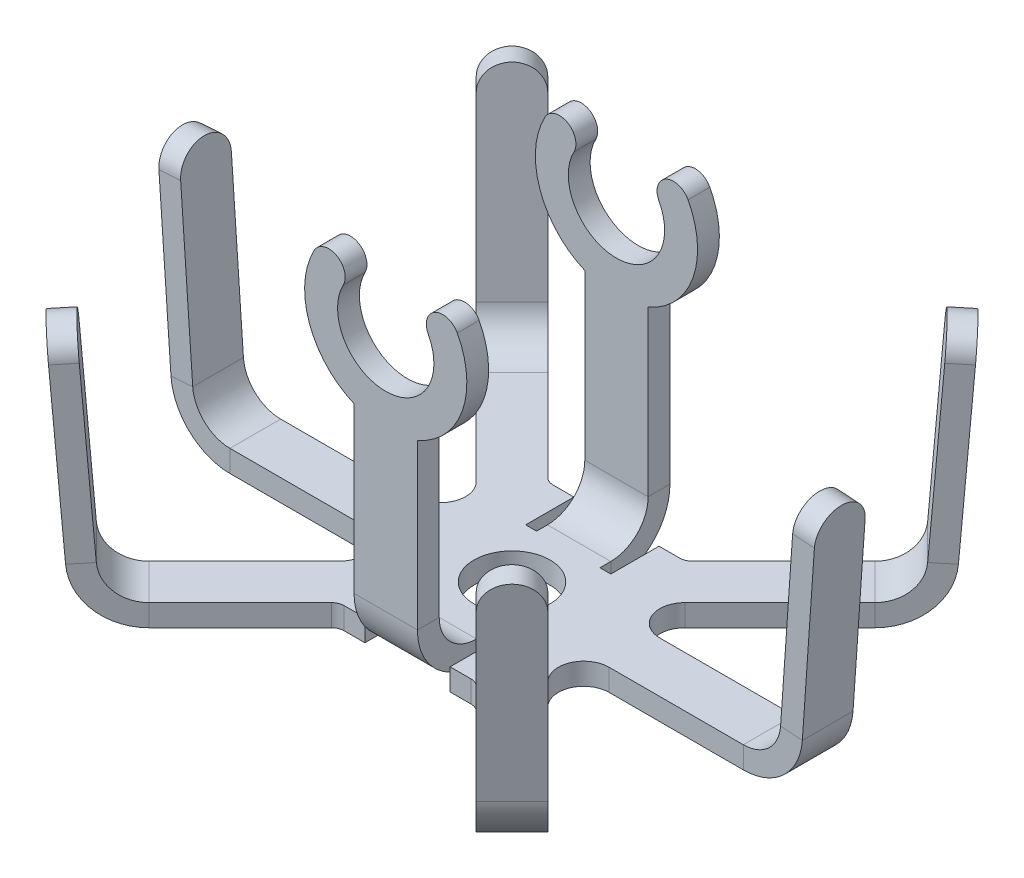
from build123d import *

# Parameters (mm, degrees)
SKETCH1_R                       = 0.75
BASE_FLANGE1_DEPTH              = 0.43
EDGE_FLANGE1_STRIP_CUT_DEPTH    = 1
EDGE_FLANGE1_DEPTH              = 1
FILLET1_RADIUS                  = 0.5
FILLET1_LENGTH                  = 0.43
CIRPATTERN1_COUNT               = 8
FILLET1_OF_CIRPATTERN1_2_RADIUS = 0.5
FILLET1_OF_CIRPATTERN1_2_LENGTH = 0.43
FILLET1_OF_CIRPATTERN1_3_RADIUS = 0.5
FILLET1_OF_CIRPATTERN1_3_LENGTH = 0.43
FILLET1_OF_CIRPATTERN1_4_RADIUS = 0.5
FILLET1_OF_CIRPATTERN1_4_LENGTH = 0.43
FILLET1_OF_CIRPATTERN1_5_RADIUS = 0.5
FILLET1_OF_CIRPATTERN1_5_LENGTH = 0.43
FILLET1_OF_CIRPATTERN1_6_RADIUS = 0.5
FILLET1_OF_CIRPATTERN1_6_LENGTH = 0.43
EDGE_FLANGE2_STRIP_W            = 3.1932
EDGE_FLANGE2_STRIP_H            = 0.43
EDGE_FLANGE2_STRIP_CUT_DEPTH    = 1.25
EDGE_FLANGE2_RELIEF_W           = 3.4082
EDGE_FLANGE2_RELIEF_H           = 0.215
EDGE_FLANGE2_RELIEF_CUT_DEPTH   = 0.43
EDGE_FLANGE2_DEPTH              = 1.25
TAB1_DEPTH                      = 0.43
FILLET2_R                       = 0.25


# Sheet-metal steps are written as plain solids
with BuildPart() as part:
    # Sketch1 → Base-Flange1 (new body)
    with BuildSketch(Plane(origin=(0, 0, 0), x_dir=(1, 0, 0), z_dir=(0, 1, 0))):
        with BuildLine():
            Line((5.75, 0.5), (2.414213562, 0.5))
            ThreePointArc((2.414213562, 0.5), (1.952273796, 0.808658284), (2.060660172, 1.353553391))
            Line((2.060660172, 1.353553391), (4.419417382, 3.712310601))
            Line((4.419417382, 3.712310601), (3.712310601, 4.419417382))
            Line((3.712310601, 4.419417382), (1.353553391, 2.060660172))
            Line((1.353553391, 2.060660172), (-1.353553391, 2.060660172))
            Line((-1.353553391, 2.060660172), (-3.712310601, 4.419417382))
            Line((-3.712310601, 4.419417382), (-4.419417382, 3.712310601))
            Line((-4.419417382, 3.712310601), (-2.060660172, 1.353553391))
            ThreePointArc((-2.060660172, 1.353553391), (-1.952273796, 0.808658284), (-2.414213562, 0.5))
            Line((-2.414213562, 0.5), (-5.75, 0.5))
            Line((-5.75, 0.5), (-5.75, -0.5))
            Line((-5.75, -0.5), (-2.414213562, -0.5))
            ThreePointArc((-2.414213562, -0.5), (-1.952273796, -0.808658284), (-2.060660172, -1.353553391))
            Line((-2.060660172, -1.353553391), (-4.419417382, -3.712310601))
            Line((-4.419417382, -3.712310601), (-3.712310601, -4.419417382))
            Line((-3.712310601, -4.419417382), (-1.353553391, -2.060660172))
            Line((-1.353553391, -2.060660172), (1.353553391, -2.060660172))
            Line((1.353553391, -2.060660172), (3.712310601, -4.419417382))
            Line((3.712310601, -4.419417382), (4.419417382, -3.712310601))
            Line((4.419417382, -3.712310601), (2.060660172, -1.353553391))
            ThreePointArc((2.060660172, -1.353553391), (1.952273796, -0.808658284), (2.414213562, -0.5))
            Line((2.414213562, -0.5), (5.75, -0.5))
            Line((5.75, -0.5), (5.75, 0.5))
        make_face()
        with Locations(Location((0, 0, 0), (0, 0, 270))):
            Circle(SKETCH1_R, mode=Mode.SUBTRACT)
    extrude(amount=-BASE_FLANGE1_DEPTH)

    # Edge-Flange1 strip (across the edge) → Edge-Flange1 strip cut (cut)
    with BuildSketch(Plane(origin=(4.419417382, 0, -3.712310601), x_dir=(-0.7053843046066381, 0.0697564737441289, 0.7053843046066409), z_dir=(-0.707106781186549, 0, -0.7071067811865462))):
        Polygon((-2.530199428, -0.254121237), (0.655222098, -0.476867609), (0.685217381, -0.047915067), (-2.500204144, 0.174831305), align=None)
    edge_flange1_strip_cut = extrude(amount=EDGE_FLANGE1_STRIP_CUT_DEPTH, mode=Mode.SUBTRACT)

    # Edge-Flange1 section (across the edge) → Edge-Flange1 (add)
    with BuildSketch(Plane(origin=(4.419417382, 0, -3.712310601), x_dir=(-0.7053843046066381, 0.0697564737441289, 0.7053843046066409), z_dir=(-0.707106781186549, 0, -0.7071067811865462))):
        with BuildLine():
            Line((-0.43, 0.686890612), (-0.43, 4.599018513))
            Line((-0.43, 4.599018513), (0, 4.599018513))
            Line((0, 4.599018513), (0, 0.686890612))
            ThreePointArc((0, 0.686890612), (0.197884863, 0.18453062), (0.685217381, -0.047915067))
            Line((0.685217381, -0.047915067), (0.655222098, -0.476867609))
            ThreePointArc((0.655222098, -0.476867609), (-0.116597228, -0.108728674), (-0.43, 0.686890612))
        make_face()
    edge_flange1 = extrude(amount=EDGE_FLANGE1_DEPTH)

    # Fillet1: full round fillet: the end face becomes a half cylinder, R = half its width
    fillet1_face = Plane((4.444369473, 4.572817893, -4.444369473), x_dir=(0.705384304607, -0.069756473744, -0.705384304607), z_dir=(0.049325275616, 0.99756405026, -0.049325275616))  # on the end face: x along it, z out of the body
    fillet1_slab = fillet1_face.offset(-FILLET1_RADIUS / 2) * Box(FILLET1_LENGTH, 2 * FILLET1_RADIUS, FILLET1_RADIUS, mode=Mode.PRIVATE)  # the body's end, R deep
    fillet1_round = Plane((4.419706835, 4.074035868, -4.419706835), x_dir=(0.049325275616, 0.99756405026, -0.049325275616), z_dir=(0.705384304607, -0.069756473744, -0.705384304607)) * Cylinder(FILLET1_RADIUS, FILLET1_LENGTH, mode=Mode.PRIVATE)  # its axis R under the face
    add(fillet1_slab - fillet1_round, mode=Mode.SUBTRACT)

    # CirPattern1: Edge-Flange1 strip cut, Edge-Flange1 ×8 about axis, 2 skipped
    cirpattern1_axis = Axis((0, -0.43, 0), (0, 1, 0))
    add([edge_flange1_strip_cut.rotate(cirpattern1_axis, i * 360 / CIRPATTERN1_COUNT) for i in range(1, CIRPATTERN1_COUNT) if i not in (1, 5)], mode=Mode.SUBTRACT)
    add([edge_flange1.rotate(cirpattern1_axis, i * 360 / CIRPATTERN1_COUNT) for i in range(1, CIRPATTERN1_COUNT) if i not in (1, 5)])

    # Fillet1 of CirPattern1 2: full round fillet: the end face becomes a half cylinder, R = half its width
    fillet1_of_cirpattern1_2_face = Plane((-4.444369473, 4.572817893, -4.444369473), x_dir=(-0.705384304607, -0.069756473744, -0.705384304607), z_dir=(-0.049325275616, 0.99756405026, -0.049325275616))  # on the end face: x along it, z out of the body
    fillet1_of_cirpattern1_2_slab = fillet1_of_cirpattern1_2_face.offset(-FILLET1_OF_CIRPATTERN1_2_RADIUS / 2) * Box(FILLET1_OF_CIRPATTERN1_2_LENGTH, 2 * FILLET1_OF_CIRPATTERN1_2_RADIUS, FILLET1_OF_CIRPATTERN1_2_RADIUS, mode=Mode.PRIVATE)  # the body's end, R deep
    fillet1_of_cirpattern1_2_round = Plane((-4.419706835, 4.074035868, -4.419706835), x_dir=(-0.049325275616, 0.99756405026, -0.049325275616), z_dir=(-0.705384304607, -0.069756473744, -0.705384304607)) * Cylinder(FILLET1_OF_CIRPATTERN1_2_RADIUS, FILLET1_OF_CIRPATTERN1_2_LENGTH, mode=Mode.PRIVATE)  # its axis R under the face
    add(fillet1_of_cirpattern1_2_slab - fillet1_of_cirpattern1_2_round, mode=Mode.SUBTRACT)

    # Fillet1 of CirPattern1 3: full round fillet: the end face becomes a half cylinder, R = half its width
    fillet1_of_cirpattern1_3_face = Plane((-6.285287585, 4.572817893, 0), x_dir=(-0.99756405026, -0.069756473744, 0), z_dir=(-0.069756473744, 0.99756405026, 0))  # on the end face: x along it, z out of the body
    fillet1_of_cirpattern1_3_slab = fillet1_of_cirpattern1_3_face.offset(-FILLET1_OF_CIRPATTERN1_3_RADIUS / 2) * Box(FILLET1_OF_CIRPATTERN1_3_LENGTH, 2 * FILLET1_OF_CIRPATTERN1_3_RADIUS, FILLET1_OF_CIRPATTERN1_3_RADIUS, mode=Mode.PRIVATE)  # the body's end, R deep
    fillet1_of_cirpattern1_3_round = Plane((-6.250409348, 4.074035868, 0), x_dir=(-0.069756473744, 0.99756405026, 0), z_dir=(-0.99756405026, -0.069756473744, 0)) * Cylinder(FILLET1_OF_CIRPATTERN1_3_RADIUS, FILLET1_OF_CIRPATTERN1_3_LENGTH, mode=Mode.PRIVATE)  # its axis R under the face
    add(fillet1_of_cirpattern1_3_slab - fillet1_of_cirpattern1_3_round, mode=Mode.SUBTRACT)

    # Fillet1 of CirPattern1 4: full round fillet: the end face becomes a half cylinder, R = half its width
    fillet1_of_cirpattern1_4_face = Plane((-4.444369473, 4.572817893, 4.444369473), x_dir=(-0.705384304607, -0.069756473744, 0.705384304607), z_dir=(-0.049325275616, 0.99756405026, 0.049325275616))  # on the end face: x along it, z out of the body
    fillet1_of_cirpattern1_4_slab = fillet1_of_cirpattern1_4_face.offset(-FILLET1_OF_CIRPATTERN1_4_RADIUS / 2) * Box(FILLET1_OF_CIRPATTERN1_4_LENGTH, 2 * FILLET1_OF_CIRPATTERN1_4_RADIUS, FILLET1_OF_CIRPATTERN1_4_RADIUS, mode=Mode.PRIVATE)  # the body's end, R deep
    fillet1_of_cirpattern1_4_round = Plane((-4.419706835, 4.074035868, 4.419706835), x_dir=(-0.049325275616, 0.99756405026, 0.049325275616), z_dir=(-0.705384304607, -0.069756473744, 0.705384304607)) * Cylinder(FILLET1_OF_CIRPATTERN1_4_RADIUS, FILLET1_OF_CIRPATTERN1_4_LENGTH, mode=Mode.PRIVATE)  # its axis R under the face
    add(fillet1_of_cirpattern1_4_slab - fillet1_of_cirpattern1_4_round, mode=Mode.SUBTRACT)

    # Fillet1 of CirPattern1 5: full round fillet: the end face becomes a half cylinder, R = half its width
    fillet1_of_cirpattern1_5_face = Plane((4.444369473, 4.572817893, 4.444369473), x_dir=(0.705384304607, -0.069756473744, 0.705384304607), z_dir=(0.049325275616, 0.99756405026, 0.049325275616))  # on the end face: x along it, z out of the body
    fillet1_of_cirpattern1_5_slab = fillet1_of_cirpattern1_5_face.offset(-FILLET1_OF_CIRPATTERN1_5_RADIUS / 2) * Box(FILLET1_OF_CIRPATTERN1_5_LENGTH, 2 * FILLET1_OF_CIRPATTERN1_5_RADIUS, FILLET1_OF_CIRPATTERN1_5_RADIUS, mode=Mode.PRIVATE)  # the body's end, R deep
    fillet1_of_cirpattern1_5_round = Plane((4.419706835, 4.074035868, 4.419706835), x_dir=(0.049325275616, 0.99756405026, 0.049325275616), z_dir=(0.705384304607, -0.069756473744, 0.705384304607)) * Cylinder(FILLET1_OF_CIRPATTERN1_5_RADIUS, FILLET1_OF_CIRPATTERN1_5_LENGTH, mode=Mode.PRIVATE)  # its axis R under the face
    add(fillet1_of_cirpattern1_5_slab - fillet1_of_cirpattern1_5_round, mode=Mode.SUBTRACT)

    # Fillet1 of CirPattern1 6: full round fillet: the end face becomes a half cylinder, R = half its width
    fillet1_of_cirpattern1_6_face = Plane((6.285287585, 4.572817893, 0), x_dir=(0.99756405026, -0.069756473744, 0), z_dir=(0.069756473744, 0.99756405026, 0))  # on the end face: x along it, z out of the body
    fillet1_of_cirpattern1_6_slab = fillet1_of_cirpattern1_6_face.offset(-FILLET1_OF_CIRPATTERN1_6_RADIUS / 2) * Box(FILLET1_OF_CIRPATTERN1_6_LENGTH, 2 * FILLET1_OF_CIRPATTERN1_6_RADIUS, FILLET1_OF_CIRPATTERN1_6_RADIUS, mode=Mode.PRIVATE)  # the body's end, R deep
    fillet1_of_cirpattern1_6_round = Plane((6.250409348, 4.074035868, 0), x_dir=(0.069756473744, 0.99756405026, 0), z_dir=(0.99756405026, -0.069756473744, 0)) * Cylinder(FILLET1_OF_CIRPATTERN1_6_RADIUS, FILLET1_OF_CIRPATTERN1_6_LENGTH, mode=Mode.PRIVATE)  # its axis R under the face
    add(fillet1_of_cirpattern1_6_slab - fillet1_of_cirpattern1_6_round, mode=Mode.SUBTRACT)

    # Edge-Flange2 strip (across the edge) → Edge-Flange2 strip cut (cut)
    with BuildSketch(Plane(origin=(0.625, 0, -2.060660172), x_dir=(0, 0, 1), z_dir=(-1, 0, 0))):
        with Locations((-0.86, -0.215)):
            Rectangle(EDGE_FLANGE2_STRIP_W, EDGE_FLANGE2_STRIP_H)
    edge_flange2_strip_cut = extrude(amount=EDGE_FLANGE2_STRIP_CUT_DEPTH, mode=Mode.SUBTRACT)

    # Edge-Flange2 relief (on the sheet) → Edge-Flange2 relief cut (cut)
    with BuildSketch(Plane(origin=(0.625, 0, -1.324060172), x_dir=(0, 0, 1), z_dir=(0, 1, 0))):
        with Locations((-1.4891, 0.1075)):
            Rectangle(EDGE_FLANGE2_RELIEF_W, EDGE_FLANGE2_RELIEF_H)
        with Locations((-1.4891, -1.3575)):
            Rectangle(EDGE_FLANGE2_RELIEF_W, EDGE_FLANGE2_RELIEF_H)
    edge_flange2_relief_cut = extrude(amount=-EDGE_FLANGE2_RELIEF_CUT_DEPTH, mode=Mode.SUBTRACT)

    # Edge-Flange2 section (across the edge) → Edge-Flange2 (add)
    with BuildSketch(Plane(origin=(0.625, 0, -2.060660172), x_dir=(0, 0, 1), z_dir=(-1, 0, 0))):
        with BuildLine():
            Line((-0.43, 0.7366), (-0.43, 4.5))
            Line((-0.43, 4.5), (0, 4.5))
            Line((0, 4.5), (0, 0.7366))
            ThreePointArc((0, 0.7366), (0.215745145, 0.215745145), (0.7366, 0))
            Line((0.7366, 0), (0.7366, -0.43))
            ThreePointArc((0.7366, -0.43), (-0.088310771, -0.088310771), (-0.43, 0.7366))
        make_face()
    edge_flange2 = extrude(amount=EDGE_FLANGE2_DEPTH)

    # Sketch13 → Tab1 (add)
    with BuildSketch(Plane.XY.offset(-2.060660172)):
        with BuildLine():
            ThreePointArc((-1.411764706, 6.202941176), (0, 3.85), (1.411764706, 6.202941176))
            ThreePointArc((1.411764706, 6.202941176), (0.972058824, 6.336764706), (0.838235294, 5.897058824))
            ThreePointArc((0.838235294, 5.897058824), (0, 4.5), (-0.838235294, 5.897058824))
            ThreePointArc((-0.838235294, 5.897058824), (-0.972058824, 6.336764706), (-1.411764706, 6.202941176))
        make_face()
    tab1 = extrude(amount=-TAB1_DEPTH)

    # Mirror1: Edge-Flange2 strip cut, Edge-Flange2 relief cut, Edge-Flange2, Tab1 across plane
    add(edge_flange2_strip_cut.mirror(Plane.XY), mode=Mode.SUBTRACT)
    add(edge_flange2_relief_cut.mirror(Plane.XY), mode=Mode.SUBTRACT)
    add(edge_flange2.mirror(Plane.XY))
    add(tab1.mirror(Plane.XY))

    # Fillet2
    fillet2_edges = [part.edges().sort_by_distance(p)[0] for p in [
        (1.353553391, -0.215, 2.060660172),
        (-1.353553391, -0.215, 2.060660172),
        (-1.353553391, -0.215, -2.060660172),
        (1.353553391, -0.215, -2.060660172),
    ]]
    fillet(fillet2_edges, radius=FILLET2_R)


solid = part.part
